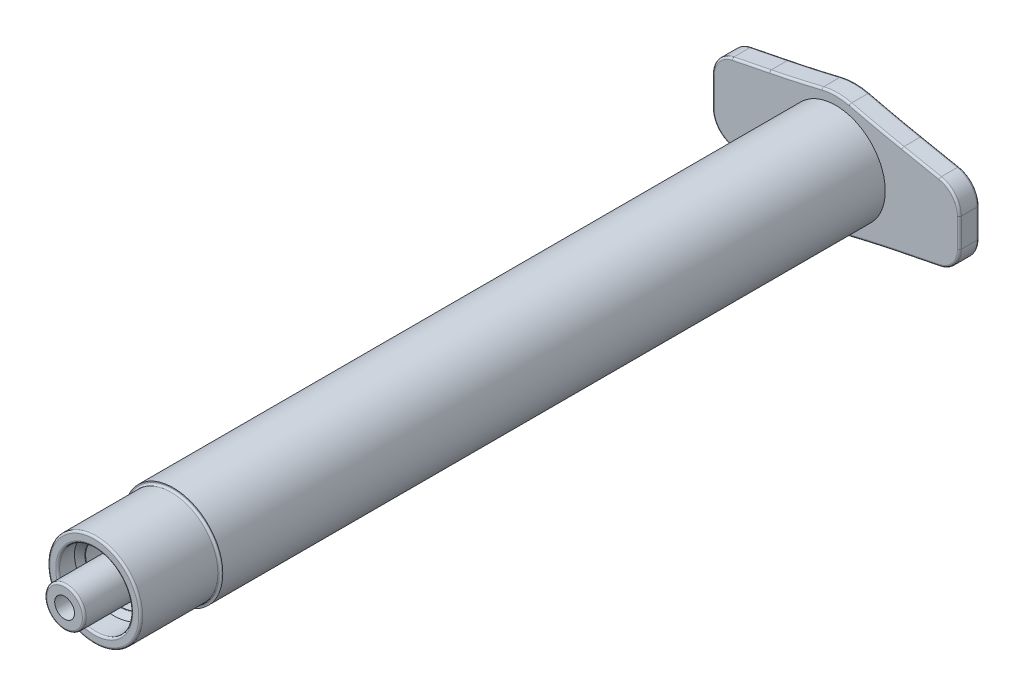
from build123d import *

# Parameters (mm, degrees)
SKETCH1_R           = 5
BOSS_EXTRUDE1_DEPTH = 68
SKETCH2_R           = 4.7
BOSS_EXTRUDE2_DEPTH = 8
FILLET3_R           = 0.2
SKETCH4_R           = 3.7
CUT_EXTRUDE1_DEPTH  = 8
FILLET4_R           = 0.2
SKETCH9_R           = 2
SKETCH9_R_2         = 1
BOSS_EXTRUDE4_DEPTH = 11
FILLET5_R           = 0.2
SKETCH8_R           = 4.005424666
CUT_EXTRUDE2_DEPTH  = 67
SKETCH10_R          = 6
SKETCH10_R_2        = 5
BOSS_EXTRUDE5_DEPTH = 1
FILLET8_R           = 132
FILLET9_R           = 2.5
FILLET11_R          = 0.2
CUT_EXTRUDE3_START  = -12
SKETCH11_R          = 1
CUT_EXTRUDE3_DEPTH  = 12
FILLET16_R          = 0.2
SWEEP1_PITCH        = 3.111111111


with BuildPart() as part:
    # Sketch1 → Boss-Extrude1 (new body)
    with BuildSketch(Plane.XY):
        Circle(SKETCH1_R)
    extrude(amount=BOSS_EXTRUDE1_DEPTH)

    # Sketch2 → Boss-Extrude2 (add)
    with BuildSketch(Plane.XY.offset(68)):
        Circle(SKETCH2_R)
    extrude(amount=BOSS_EXTRUDE2_DEPTH)

    # Fillet3
    fillet3_edges = [part.edges().sort_by_distance(p)[0] for p in [
        (-4.7, 0, 68),
    ]]
    fillet(fillet3_edges, radius=FILLET3_R)

    # Sketch4 → Cut-Extrude1 (cut)
    with BuildSketch(Plane.XY.offset(76)):
        Circle(SKETCH4_R)
    extrude(amount=-CUT_EXTRUDE1_DEPTH, mode=Mode.SUBTRACT)

    # Fillet4
    fillet4_edges = [part.edges().sort_by_distance(p)[0] for p in [
        (-3.7, 0, 76),
        (-4.7, 0, 76),
    ]]
    fillet(fillet4_edges, radius=FILLET4_R)

    # Sketch9 → Boss-Extrude4 (add)
    with BuildSketch(Plane.XY.offset(68)):
        Circle(SKETCH9_R)
        Circle(SKETCH9_R_2, mode=Mode.SUBTRACT)
    extrude(amount=BOSS_EXTRUDE4_DEPTH)

    # Fillet5
    fillet5_edges = [part.edges().sort_by_distance(p)[0] for p in [
        (-2, 0, 79),
    ]]
    fillet(fillet5_edges, radius=FILLET5_R)

    # Sketch8 → Cut-Extrude2 (cut)
    with BuildSketch(Plane(origin=(0, 0, 0), x_dir=(-1, 0, 0), z_dir=(0, 0, -1))):
        Circle(SKETCH8_R)
    extrude(amount=-CUT_EXTRUDE2_DEPTH, mode=Mode.SUBTRACT)

    # Sketch11 → Cut-Extrude3 (cut)
    with BuildSketch(Plane.XY.offset(79).offset(CUT_EXTRUDE3_START)):
        Circle(SKETCH11_R)
    extrude(amount=CUT_EXTRUDE3_DEPTH, mode=Mode.SUBTRACT)

    # Fillet16
    fillet16_edges = [part.edges().sort_by_distance(p)[0] for p in [
        (-1, 0, 67),
    ]]
    fillet(fillet16_edges, radius=FILLET16_R)

    # Sweep1: the profile of Sketch13 screwed along a left-hand helix of 2.25 turns, 10 arcs to a turn; built about Z, then put on its axis
    sweep1_z = Axis((0, 0, 0), (0, 0, 1))
    sweep1_corners = [(3.121750443, -0.015629944, -0.116794797), (4.107165671, -0.068231827, -0.509862498), (3.945729645, 0.082637783, 0.617511043), (3.109580796, -0.004256833, -0.031809198), (3.090913684, -0.010409368, -0.07778403)]
    with BuildLine(mode=Mode.PRIVATE) as sweep1_profile:
        Line(sweep1_corners[0], sweep1_corners[1])
        Line(sweep1_corners[1], sweep1_corners[2])
        Line(sweep1_corners[2], sweep1_corners[3])
        ThreePointArc((3.109580796, -0.004256833, -0.031809198), (3.094032871, -0.007001375, -0.052317793), (3.090913684, -0.010409368, -0.07778403))
        ThreePointArc((3.090913684, -0.010409368, -0.07778403), (3.101059019, -0.013567644, -0.101384252), (3.121750443, -0.015629944, -0.116794797))
    sweep1_cap = Face(sweep1_profile.wire())
    sweep1_arcs = [((3.109580796, -0.004256833, -0.031809198), (3.086857135, -0.006618331, -0.049455497), (3.090913684, -0.010409368, -0.07778403), (1, 0.8660254037844358, 1)), ((3.090913684, -0.010409368, -0.07778403), (3.094970233, -0.014200405, -0.106112564), (3.121750443, -0.015629944, -0.116794797), (1, 0.8660254037844358, 1))]  # start, shoulder, end, weights
    sweep1_turn_angles = [0, -18, -36, -54, -72, -90, -108, -126, -144, -162, -180, -198, -216, -234, -252, -270, -288, -306, -324, -342, -360]
    sweep1_turn_weights = [1, 0.9510565162951535, 1, 0.9510565162951535, 1, 0.9510565162951535, 1, 0.9510565162951535, 1, 0.9510565162951535, 1, 0.9510565162951535, 1, 0.9510565162951535, 1, 0.9510565162951535, 1, 0.9510565162951535, 1, 0.9510565162951535, 1]
    sweep1_turn_rails = [Edge.make_bspline([Vector(p[0], p[1], 0).rotate(sweep1_z, sweep1_turn_angles[k]) / sweep1_turn_weights[k] + Vector(0, 0, p[2] + -SWEEP1_PITCH * sweep1_turn_angles[k] / 360) for k in range(21)], [0, 0, 0, 1, 1, 2, 2, 3, 3, 4, 4, 5, 5, 6, 6, 7, 7, 8, 8, 9, 9, 10, 10, 10], 2, sweep1_turn_weights) for p in sweep1_corners]
    sweep1_turn_sides = [*[Face.make_surface_from_curves(sweep1_turn_rails[p[0]], sweep1_turn_rails[p[1]]) for p in [(0, 1), (1, 2), (2, 3)]], *[Face.make_bezier_surface([[Vector(p[j][0], p[j][1], 0).rotate(sweep1_z, sweep1_turn_angles[2 * i + k]) / sweep1_turn_weights[2 * i + k] + Vector(0, 0, p[j][2] + -SWEEP1_PITCH * sweep1_turn_angles[2 * i + k] / 360) for k in range(3)] for j in range(3)], [[p[3][j] * sweep1_turn_weights[2 * i + k] for k in range(3)] for j in range(3)]) for p in sweep1_arcs for i in range(10)]]
    sweep1_last_angles = [-720, -738, -756, -774, -792, -801, -810]
    sweep1_last_weights = [1, 0.9510565162951535, 1, 0.9510565162951535, 1, 0.987688340595136, 1]
    sweep1_last_rails = [Edge.make_bspline([Vector(p[0], p[1], 0).rotate(sweep1_z, sweep1_last_angles[k]) / sweep1_last_weights[k] + Vector(0, 0, p[2] + -SWEEP1_PITCH * sweep1_last_angles[k] / 360) for k in range(7)], [0, 0, 0, 1, 1, 2, 2, 3, 3, 3], 2, sweep1_last_weights) for p in sweep1_corners]
    sweep1_last_sides = [*[Face.make_surface_from_curves(sweep1_last_rails[p[0]], sweep1_last_rails[p[1]]) for p in [(0, 1), (1, 2), (2, 3)]], *[Face.make_bezier_surface([[Vector(p[j][0], p[j][1], 0).rotate(sweep1_z, sweep1_last_angles[2 * i + k]) / sweep1_last_weights[2 * i + k] + Vector(0, 0, p[j][2] + -SWEEP1_PITCH * sweep1_last_angles[2 * i + k] / 360) for k in range(3)] for j in range(3)], [[p[3][j] * sweep1_last_weights[2 * i + k] for k in range(3)] for j in range(3)]) for p in sweep1_arcs for i in range(3)]]
    sweep1 = Plane(origin=(0, 0, 68), x_dir=(-0.7071067811865512, 0.7071067811865438, 0), z_dir=(0, 0, 1)) * Solid(Shell([*[p.moved(Location((0, 0, SWEEP1_PITCH * i))) for i in range(2) for p in sweep1_turn_sides], *sweep1_last_sides, sweep1_cap, sweep1_cap.rotate(sweep1_z, -810).moved(Location((0, 0, -SWEEP1_PITCH * -810 / 360)))]))
    add(sweep1)


with BuildPart() as body_2:
    # Sketch10 → Boss-Extrude5 (new, symmetric)
    # profile 1 of 3: a face of its own
    with BuildSketch(Plane(origin=(0, 0, 0), x_dir=(-1, 0, 0), z_dir=(0, 0, -1))):
        with BuildLine():
            ThreePointArc((-2.307692308, -5.538461538), (-6, 0), (-2.307692308, 5.538461538))
            Line((-2.307692308, 5.538461538), (-12.5, 3.5))
            Line((-12.5, 3.5), (-12.5, -3.5))
            Line((-12.5, -3.5), (-2.307692308, -5.538461538))
        make_face()
    # profile 2 of 3: a face of its own
    with BuildSketch(Plane(origin=(0, 0, 0), x_dir=(-1, 0, 0), z_dir=(0, 0, -1))):
        with BuildLine():
            Line((12.5, -3.5), (12.5, 3.5))
            Line((12.5, 3.5), (2.307692308, 5.538461538))
            ThreePointArc((2.307692308, 5.538461538), (4.992301766, 3.328201177), (6, 0))
            ThreePointArc((6, 0), (4.992301766, -3.328201177), (2.307692308, -5.538461538))
            Line((2.307692308, -5.538461538), (12.5, -3.5))
        make_face()
    # profile 3 of 3: a face of its own
    with BuildSketch(Plane(origin=(0, 0, 0), x_dir=(-1, 0, 0), z_dir=(0, 0, -1))):
        Circle(SKETCH10_R)
        Circle(SKETCH10_R_2, mode=Mode.SUBTRACT)
    extrude(amount=BOSS_EXTRUDE5_DEPTH, both=True)

    # Fillet8
    fillet8_edges = [body_2.edges().sort_by_distance(p)[0] for p in [
        (2.307692308, 5.538461538, 0),
        (-2.307692308, 5.538461538, 0),
        (-2.307692308, -5.538461538, 0),
        (2.307692308, -5.538461538, 0),
    ]]
    fillet(fillet8_edges, radius=FILLET8_R)

    # Fillet9
    fillet9_edges = [body_2.edges().sort_by_distance(p)[0] for p in [
        (12.5, -3.5, 0),
        (12.5, 3.5, 0),
        (-12.5, 3.5, 0),
        (-12.5, -3.5, 0),
    ]]
    fillet(fillet9_edges, radius=FILLET9_R)

    # Fillet11
    fillet11_edges = [body_2.edges().sort_by_distance(p)[0] for p in [
        (0, -6, 1),
        (0, -6, -1),
        (-8.601838275, -4.279632345, 1),
        (-8.601838275, -4.279632345, -1),
        (8.601838275, 4.279632345, 1),
        (8.601838275, 4.279632345, -1),
        (0, 6, 1),
        (0, 6, -1),
        (4.059379194, -5.216541456, 1),
        (4.059379194, -5.216541456, -1),
        (-4.059379194, -5.216541456, 1),
        (-4.059379194, -5.216541456, -1),
        (4.059379194, 5.216541456, 1),
        (4.059379194, 5.216541456, -1),
        (-4.059379194, 5.216541456, 1),
        (-4.059379194, 5.216541456, -1),
        (-12.5, 0, 1),
        (-12.5, 0, -1),
        (8.601838275, -4.279632345, 1),
        (12.5, 0, 1),
        (-8.601838275, 4.279632345, 1),
        (11.933355353, -3.035462507, 1),
        (11.933355353, 3.035462507, 1),
        (-11.933355353, 3.035462507, 1),
        (-11.933355353, -3.035462507, 1),
        (8.601838275, -4.279632345, -1),
        (-8.601838275, 4.279632345, -1),
        (12.5, 0, -1),
        (11.933355353, -3.035462507, -1),
        (11.933355353, 3.035462507, -1),
        (-11.933355353, 3.035462507, -1),
        (-11.933355353, -3.035462507, -1),
    ]]
    fillet(fillet11_edges, radius=FILLET11_R)


solid = Compound([part.part, body_2.part])
